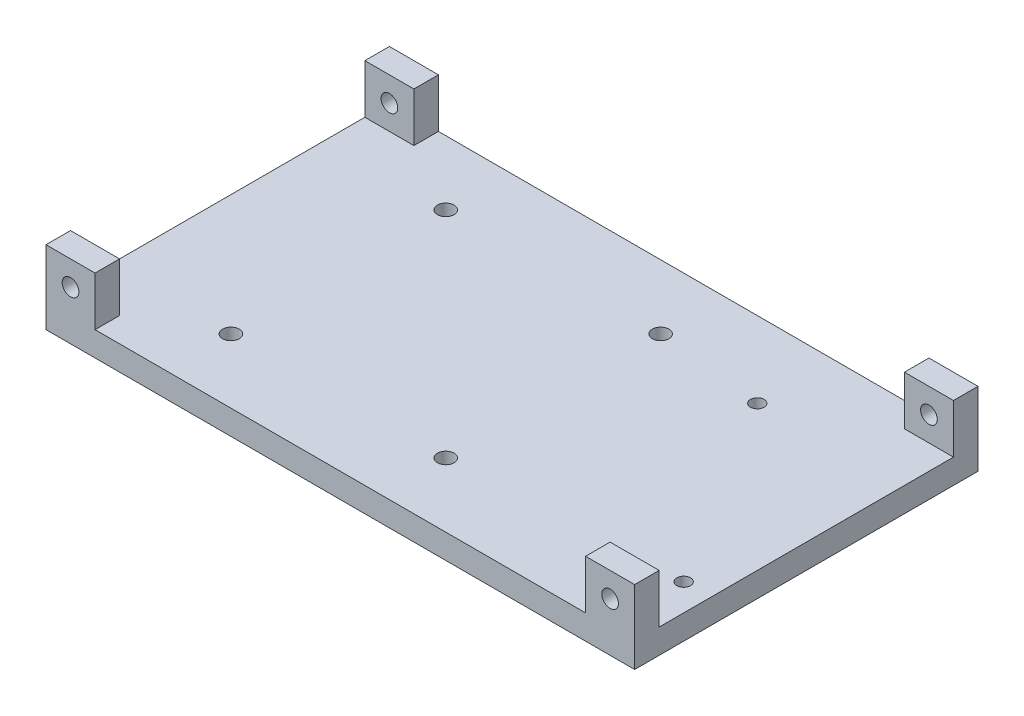
from build123d import *

# Parameters (mm, degrees)
SKETCH1_W            = 120
SKETCH1_H            = 70
BOSS_EXTRUDE2_DEPTH  = 5
SKETCH2_W            = 10
SKETCH2_H            = 5
BOSS_EXTRUDE3_DEPTH  = 10
M3_CLEARANCE_HOLE1_D = 3.4
SKETCH5_R            = 1.39
CUT_EXTRUDE1_DEPTH   = 140.731886125
M3_CLEARANCE_HOLE2_D = 3.4


with BuildPart() as part:
    # Sketch1 → Boss-Extrude2 (new body)
    with BuildSketch(Plane(origin=(0, 0, 0), x_dir=(1, 0, 0), z_dir=(0, 1, 0))):
        with Locations((-60, 35)):
            Rectangle(SKETCH1_W, SKETCH1_H)
    extrude(amount=BOSS_EXTRUDE2_DEPTH)

    # Sketch2 → Boss-Extrude3 (add)
    with BuildSketch(Plane(origin=(0, 5, 0), x_dir=(1, 0, 0), z_dir=(0, 1, 0))):
        with Locations((-115, 2.5)):
            Rectangle(SKETCH2_W, SKETCH2_H)
        with Locations((-115, 67.5)):
            Rectangle(SKETCH2_W, SKETCH2_H)
        with Locations((-5, 2.5)):
            Rectangle(SKETCH2_W, SKETCH2_H)
        with Locations((-5, 67.5)):
            Rectangle(SKETCH2_W, SKETCH2_H)
    extrude(amount=BOSS_EXTRUDE3_DEPTH)

    # M3 Clearance Hole1 (through all)
    with Locations(Plane.XY):
        with Locations((-115, 10), (-5, 10)):
            Hole(M3_CLEARANCE_HOLE1_D / 2)

    # Sketch5 → Cut-Extrude1 (cut, through all)
    with BuildSketch(Plane.XZ):
        with Locations((-29.5, -54.5)):
            Circle(SKETCH5_R)
        with Locations((-5.5, -15.5)):
            Circle(SKETCH5_R)
    extrude(amount=-CUT_EXTRUDE1_DEPTH, mode=Mode.SUBTRACT)

    # M3 Clearance Hole2 (through all)
    with Locations(Plane(origin=(0, 0, 0), x_dir=(-1, 0, 0), z_dir=(0, -1, 0))):
        with Locations((95.4, 13.1), (51.6, 13.1), (51.6, 56.9), (95.4, 56.9)):
            Hole(M3_CLEARANCE_HOLE2_D / 2)


solid = part.part
